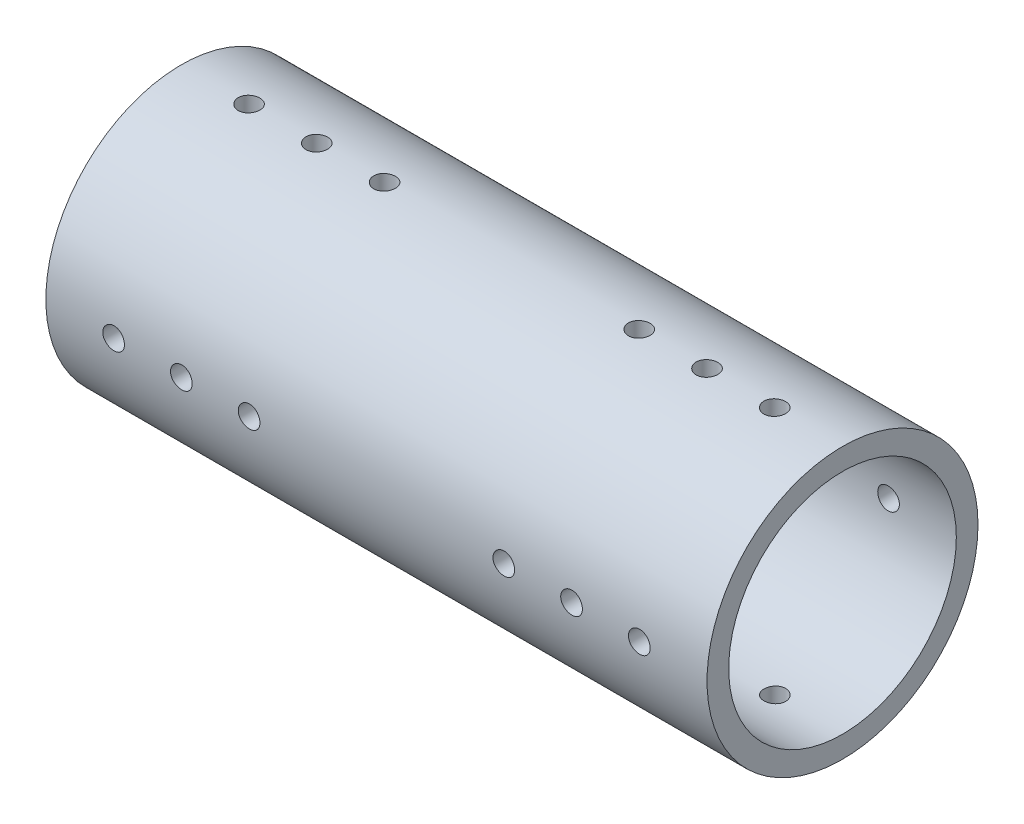
from build123d import *

# Parameters (mm, degrees)
SKETCH_2_R               = 25
SKETCH_2_R_2             = 21
EXTRUDE_2_DEPTH          = 122
CUT_EXTRUDE_START        = -135.197615478
SKETCH_4_R               = 2
CUT_EXTRUDE_2_DEPTH      = 145.197615478
PATTERN_CIRCULAR_1_COUNT = 4


with BuildPart() as part:
    # Эскиз2 → Бобышка-Вытянуть2 (new body)
    with BuildSketch(Plane(origin=(0, 0, 0), x_dir=(0, 0, -1), z_dir=(1, 0, 0))):
        Circle(SKETCH_2_R)
        Circle(SKETCH_2_R_2, mode=Mode.SUBTRACT)
    extrude(amount=EXTRUDE_2_DEPTH)

    # Эскиз4 → Вырез-Вытянуть2 (cut)
    with BuildSketch(Plane.XY.offset(25).offset(CUT_EXTRUDE_START)):
        with Locations((12.5, 0)):
            Circle(SKETCH_4_R)
        with Locations((109.5, 0)):
            Circle(SKETCH_4_R)
        with Locations((25, 0)):
            Circle(SKETCH_4_R)
        with Locations((37.5, 0)):
            Circle(SKETCH_4_R)
        with Locations((97, 0)):
            Circle(SKETCH_4_R)
        with Locations((84.5, 0)):
            Circle(SKETCH_4_R)
    cut_extrude_2 = extrude(amount=CUT_EXTRUDE_2_DEPTH, mode=Mode.SUBTRACT)

    # Круговой массив1: Вырез-Вытянуть2 ×4 about axis
    pattern_circular_1_axis = Axis((122, 0, 0), (-1, 0, 0))
    for i in range(1, PATTERN_CIRCULAR_1_COUNT):
        add(cut_extrude_2.rotate(pattern_circular_1_axis, i * 360 / PATTERN_CIRCULAR_1_COUNT), mode=Mode.SUBTRACT)


solid = part.part
